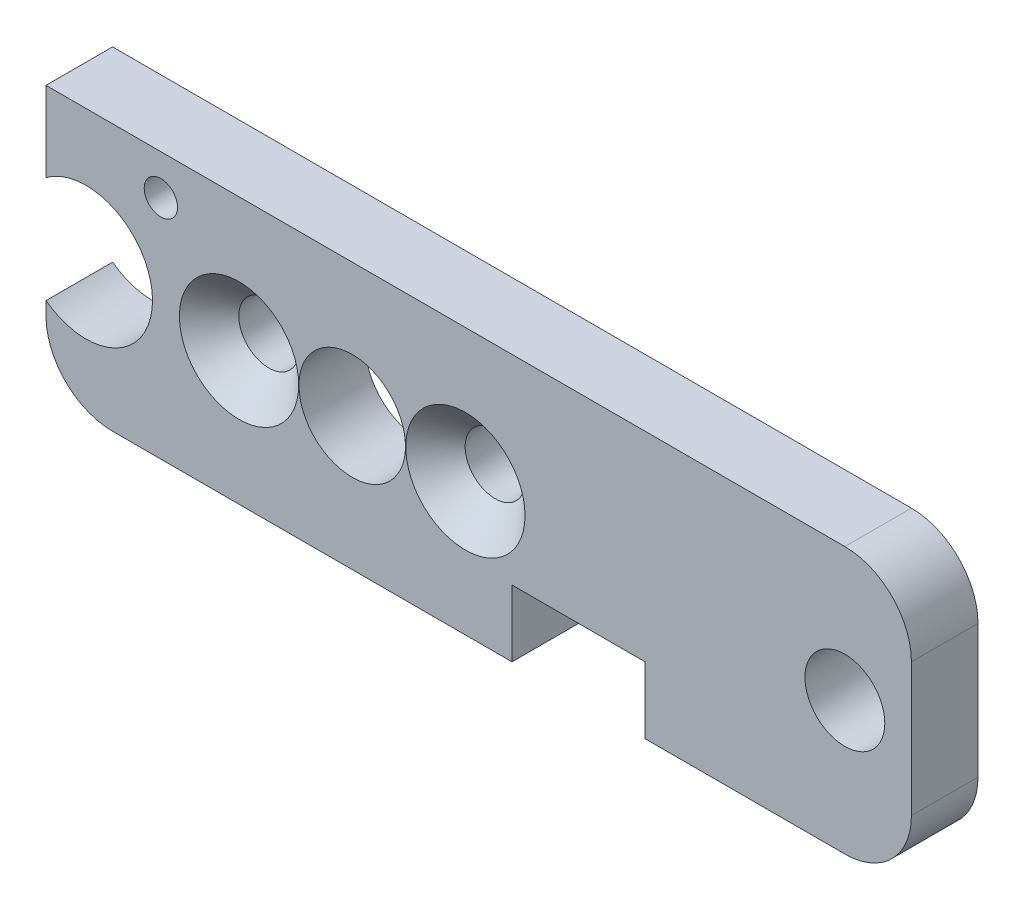
from build123d import *

# Parameters (mm, degrees)
SKETCH1_W                                            = 65
SKETCH1_H                                            = 20
BOSS_EXTRUDE1_DEPTH                                  = 5
F_10_0MM_DOWEL_HOLE1_D                               = 10
F_10_0MM_DOWEL_HOLE1_DEPTH                           = 25
F_10_0MM_DOWEL_HOLE1_TIP                             = 3.004303095
CSK_FOR_M4_HEX_SOCKET_COUNTERSUNK_CAP_SC_D           = 4.5
CSK_FOR_M4_HEX_SOCKET_COUNTERSUNK_CAP_SC_CSINK_D     = 8.96
CSK_FOR_M4_HEX_SOCKET_COUNTERSUNK_CAP_SC_CSINK_ANGLE = 90
F_6_0MM_DOWEL_HOLE1_D                                = 6
F_6_0MM_DOWEL_HOLE1_DEPTH                            = 25
F_6_0MM_DOWEL_HOLE1_TIP                              = 1.802581857
F_4_0MM_DOWEL_HOLE2_D                                = 4
F_4_0MM_DOWEL_HOLE2_DEPTH                            = 25
F_4_0MM_DOWEL_HOLE2_TIP                              = 1.201721238
F_8_0MM_DOWEL_HOLE1_D                                = 8
F_8_0MM_DOWEL_HOLE1_DEPTH                            = 5
F_8_0MM_DOWEL_HOLE1_TIP                              = 2.403442476
SKETCH22_W                                           = 10
SKETCH22_H                                           = 5
CUT_EXTRUDE1_DEPTH                                   = 10
M2_TAPPED_HOLE2_D                                    = 1.6
M2_TAPPED_HOLE2_DEPTH                                = 7
M2_TAPPED_HOLE2_TIP                                  = 0.480688495
FILLET1_R                                            = 5
M3_TAPPED_HOLE2_D                                    = 2.5
M3_TAPPED_HOLE2_DEPTH                                = 7.5
M3_TAPPED_HOLE2_TIP                                  = 0.751075774


with BuildPart() as part:
    # Sketch1 → Boss-Extrude1 (new body)
    with BuildSketch(Plane.XY):
        with Locations((5.197000354, -2.580625299)):
            Rectangle(SKETCH1_W, SKETCH1_H)
    extrude(amount=BOSS_EXTRUDE1_DEPTH)

    # Ø10.0mm Dowel Hole1
    with Locations(Plane(origin=(-24.302999646, -2.580625299, 5), x_dir=(1, 0, 0), z_dir=(0, 0, 1))):
        with Locations((0, 0)):
            Hole(F_10_0MM_DOWEL_HOLE1_D / 2, depth=F_10_0MM_DOWEL_HOLE1_DEPTH)
            with Locations((0, 0, -(F_10_0MM_DOWEL_HOLE1_DEPTH + F_10_0MM_DOWEL_HOLE1_TIP / 2))):  # 118° drill point
                Cone(0, F_10_0MM_DOWEL_HOLE1_D / 2, F_10_0MM_DOWEL_HOLE1_TIP, mode=Mode.SUBTRACT)

    # CSK for M4 Hex Socket Countersunk Cap Screw1 (through all)
    with Locations(Plane(origin=(-12.802999646, -2.580625299, 5), x_dir=(1, 0, 0), z_dir=(0, 0, 1))):
        with Locations((0, 0), (17, 0)):
            CounterSinkHole(CSK_FOR_M4_HEX_SOCKET_COUNTERSUNK_CAP_SC_D / 2, CSK_FOR_M4_HEX_SOCKET_COUNTERSUNK_CAP_SC_CSINK_D / 2, counter_sink_angle=CSK_FOR_M4_HEX_SOCKET_COUNTERSUNK_CAP_SC_CSINK_ANGLE)

    # Ø6.0mm Dowel Hole1
    with Locations(Plane(origin=(32.697000354, -2.580625299, 5), x_dir=(1, 0, 0), z_dir=(0, 0, 1))):
        with Locations((0, 0)):
            Hole(F_6_0MM_DOWEL_HOLE1_D / 2, depth=F_6_0MM_DOWEL_HOLE1_DEPTH)
            with Locations((0, 0, -(F_6_0MM_DOWEL_HOLE1_DEPTH + F_6_0MM_DOWEL_HOLE1_TIP / 2))):  # 118° drill point
                Cone(0, F_6_0MM_DOWEL_HOLE1_D / 2, F_6_0MM_DOWEL_HOLE1_TIP, mode=Mode.SUBTRACT)

    # Ø4.0mm Dowel Hole2
    with Locations(Plane(origin=(-4.302999646, -2.580625299, 0), x_dir=(-1, 0, 0), z_dir=(0, 0, -1))):
        with Locations((0, 0)):
            Hole(F_4_0MM_DOWEL_HOLE2_D / 2, depth=F_4_0MM_DOWEL_HOLE2_DEPTH)
            with Locations((0, 0, -(F_4_0MM_DOWEL_HOLE2_DEPTH + F_4_0MM_DOWEL_HOLE2_TIP / 2))):  # 118° drill point
                Cone(0, F_4_0MM_DOWEL_HOLE2_D / 2, F_4_0MM_DOWEL_HOLE2_TIP, mode=Mode.SUBTRACT)

    # Ø8.0mm Dowel Hole1
    with Locations(Plane(origin=(-4.302999646, -2.580625299, 0), x_dir=(-1, 0, 0), z_dir=(0, 0, -1))):
        with Locations((0, 0)):
            Hole(F_8_0MM_DOWEL_HOLE1_D / 2, depth=F_8_0MM_DOWEL_HOLE1_DEPTH)
            with Locations((0, 0, -(F_8_0MM_DOWEL_HOLE1_DEPTH + F_8_0MM_DOWEL_HOLE1_TIP / 2))):  # 118° drill point
                Cone(0, F_8_0MM_DOWEL_HOLE1_D / 2, F_8_0MM_DOWEL_HOLE1_TIP, mode=Mode.SUBTRACT)

    # Sketch22 → Cut-Extrude1 (cut)
    with BuildSketch(Plane(origin=(0, 0, 0), x_dir=(-1, 0, 0), z_dir=(0, 0, -1))):
        with Locations((-12.697000354, -10.080625299)):
            Rectangle(SKETCH22_W, SKETCH22_H)
    extrude(amount=-CUT_EXTRUDE1_DEPTH, mode=Mode.SUBTRACT)

    # M2 Tapped Hole2
    with Locations(Plane(origin=(12.697000354, -7.580625299, 2.5), x_dir=(-1, 0, 0), z_dir=(0, -1, 0))):
        with Locations((0, 0)):
            Hole(M2_TAPPED_HOLE2_D / 2, depth=M2_TAPPED_HOLE2_DEPTH)
            with Locations((0, 0, -(M2_TAPPED_HOLE2_DEPTH + M2_TAPPED_HOLE2_TIP / 2))):  # 118° drill point
                Cone(0, M2_TAPPED_HOLE2_D / 2, M2_TAPPED_HOLE2_TIP, mode=Mode.SUBTRACT)

    # Fillet1
    fillet1_edges = [part.edges().sort_by_distance(p)[0] for p in [
        (37.697000354, 7.419374701, 2.5),
        (37.697000354, -12.580625299, 2.5),
        (-27.302999646, -12.580625299, 2.5),
    ]]
    fillet(fillet1_edges, radius=FILLET1_R)

    # M3 Tapped Hole2
    with Locations(Plane(origin=(-18.67644652, 4.419374701, 0), x_dir=(-1, 0, 0), z_dir=(0, 0, -1))):
        with Locations((0, 0)):
            Hole(M3_TAPPED_HOLE2_D / 2, depth=M3_TAPPED_HOLE2_DEPTH)
            with Locations((0, 0, -(M3_TAPPED_HOLE2_DEPTH + M3_TAPPED_HOLE2_TIP / 2))):  # 118° drill point
                Cone(0, M3_TAPPED_HOLE2_D / 2, M3_TAPPED_HOLE2_TIP, mode=Mode.SUBTRACT)


solid = part.part
